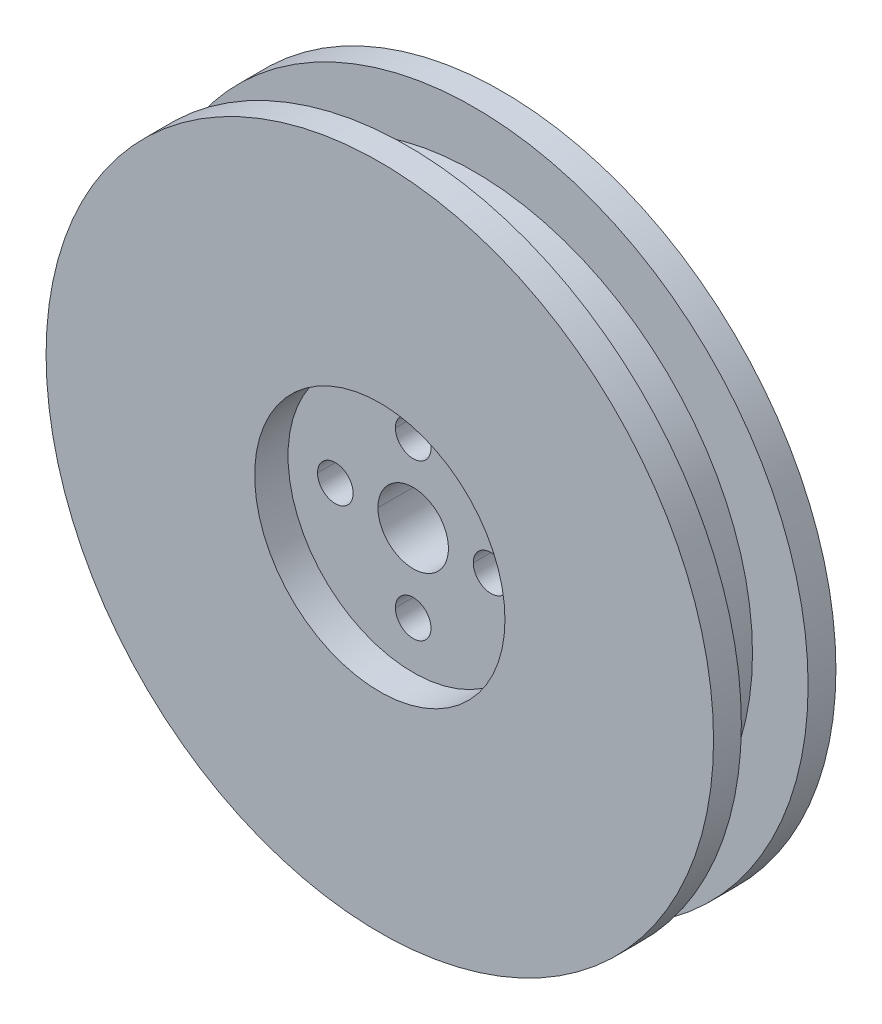
from build123d import *

# Parameters (mm, degrees)
CUT_EXTRUDE1_START         = -11
CUT_EXTRUDE1_OUTLINE_R     = 25
CUT_EXTRUDE1_OUTLINE_R_2   = 10.5
CUT_EXTRUDE1_DEPTH         = 11
CUT_EXTRUDE1_2_OUTLINE_R   = 10.5
CUT_EXTRUDE1_2_OUTLINE_R_2 = 1.6
CUT_EXTRUDE1_2_OUTLINE_R_3 = 3.16810248
CUT_EXTRUDE1_2_DEPTH       = 8
SKETCH2_R                  = 30
BOSS_EXTRUDE1_DEPTH        = 2.5
BOSS_EXTRUDE2_START        = -2.5
SKETCH3_R                  = 30
BOSS_EXTRUDE2_DEPTH        = 2.5
SKETCH4_R                  = 11.25
CUT_EXTRUDE2_DEPTH         = 3
CUT_EXTRUDE3_START         = -3
SKETCH5_R                  = 3.16810248
CUT_EXTRUDE3_DEPTH         = 3
CUT_EXTRUDE4_START         = -3
SKETCH7_R                  = 11.25
CUT_EXTRUDE4_DEPTH         = 3


with BuildPart() as part:
    # Cut-Extrude1: read off the stored shape, not the designer's step
    # Cut-Extrude1 outline → Cut-Extrude1 (new body)
    with BuildSketch(Plane.XY.offset(11).offset(CUT_EXTRUDE1_START)):
        Circle(CUT_EXTRUDE1_OUTLINE_R)
        Circle(CUT_EXTRUDE1_OUTLINE_R_2, mode=Mode.SUBTRACT)
    extrude(amount=CUT_EXTRUDE1_DEPTH)

    # Cut-Extrude1 2 outline → Cut-Extrude1 2 (add)
    with BuildSketch(Plane.XY.offset(11).offset(CUT_EXTRUDE1_START)):
        Circle(CUT_EXTRUDE1_2_OUTLINE_R)
        with Locations((0, -7)):
            Circle(CUT_EXTRUDE1_2_OUTLINE_R_2, mode=Mode.SUBTRACT)
        with Locations((-7, 0)):
            Circle(CUT_EXTRUDE1_2_OUTLINE_R_2, mode=Mode.SUBTRACT)
        Circle(CUT_EXTRUDE1_2_OUTLINE_R_3, mode=Mode.SUBTRACT)
        with Locations((7, 0)):
            Circle(CUT_EXTRUDE1_2_OUTLINE_R_2, mode=Mode.SUBTRACT)
        with Locations((0, 7)):
            Circle(CUT_EXTRUDE1_2_OUTLINE_R_2, mode=Mode.SUBTRACT)
    extrude(amount=CUT_EXTRUDE1_2_DEPTH)

    # Sketch2 → Boss-Extrude1 (add)
    with BuildSketch(Plane.XY.offset(11)):
        Circle(SKETCH2_R)
    extrude(amount=-BOSS_EXTRUDE1_DEPTH)

    # Sketch3 → Boss-Extrude2 (add)
    with BuildSketch(Plane(origin=(0, 0, 0), x_dir=(-1, 0, 0), z_dir=(0, 0, -1)).offset(BOSS_EXTRUDE2_START)):
        with Locations(Location((0, 0, 0), (0, 0, 180))):
            Circle(SKETCH3_R)
    extrude(amount=BOSS_EXTRUDE2_DEPTH)

    # Sketch4 → Cut-Extrude2 (cut)
    with BuildSketch(Plane.XY.offset(11)):
        Circle(SKETCH4_R)
    extrude(amount=-CUT_EXTRUDE2_DEPTH, mode=Mode.SUBTRACT)

    # Sketch5 → Cut-Extrude3 (cut)
    with BuildSketch(Plane.XY.offset(2.5).offset(CUT_EXTRUDE3_START)):
        Circle(SKETCH5_R)
    extrude(amount=CUT_EXTRUDE3_DEPTH, mode=Mode.SUBTRACT)

    # Sketch7 → Cut-Extrude4 (cut)
    with BuildSketch(Plane(origin=(0, 0, 0), x_dir=(-1, 0, 0), z_dir=(0, 0, -1)).offset(CUT_EXTRUDE4_START)):
        with Locations(Location((0, 0, 0), (0, 0, 180))):
            Circle(SKETCH7_R)
    extrude(amount=CUT_EXTRUDE4_DEPTH, mode=Mode.SUBTRACT)


solid = part.part
